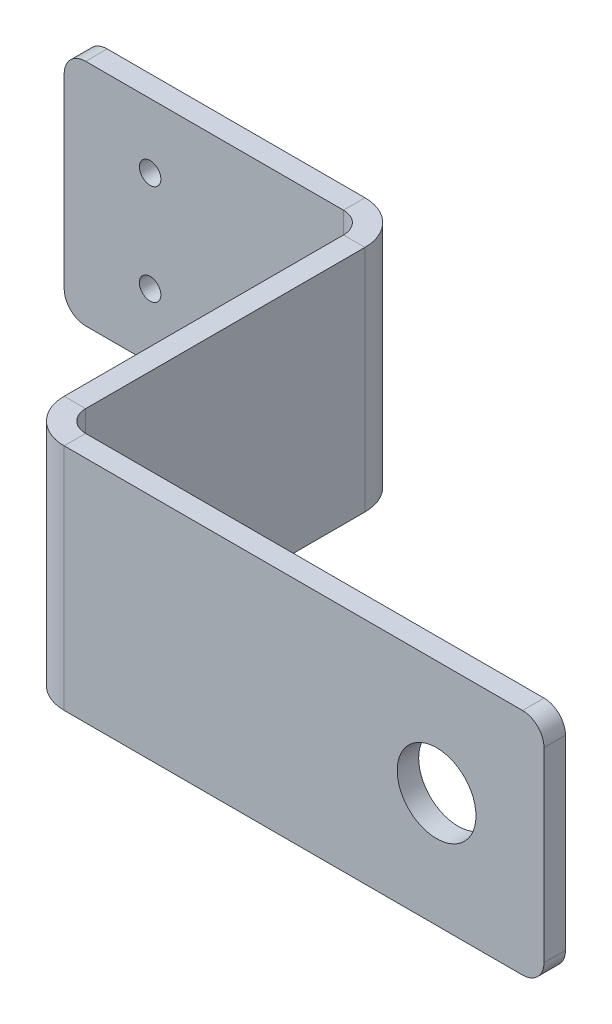
from build123d import *

# Parameters (mm, degrees)
BASE_FLANGE1_DEPTH = 32
CUT_EXTRUDE1_REACH = 130.658
SKETCH7_R          = 1.5
CUT_EXTRUDE2_REACH = 131.808
SKETCH8_R          = 5.5
FILLET1_R          = 3


# Sheet-metal steps are written as plain solids
with BuildPart() as part:
    # Sketch2 → Base-Flange1 (new body)
    with BuildSketch(Plane(origin=(0, 0, 0), x_dir=(1, 0, 0), z_dir=(0, 1, 0))):
        with BuildLine():
            Line((-115, 48), (-76, 48))
            ThreePointArc((-76, 48), (-71.757359313, 46.242640687), (-70, 42))
            Line((-70, 42), (-70, 3))
            ThreePointArc((-70, 3), (-69.121320344, 0.878679656), (-67, 0))
            Line((-67, 0), (0, 0))
            Line((0, 0), (0, -3))
            Line((0, -3), (-67, -3))
            ThreePointArc((-67, -3), (-71.242640687, -1.242640687), (-73, 3))
            Line((-73, 3), (-73, 42))
            ThreePointArc((-73, 42), (-73.878679656, 44.121320344), (-76, 45))
            Line((-76, 45), (-115, 45))
            Line((-115, 45), (-115, 48))
        make_face()
    extrude(amount=BASE_FLANGE1_DEPTH)

    # Sketch7 → Cut-Extrude1 (cut, up to next)
    with BuildSketch(Plane.XY.offset(-45), mode=Mode.PRIVATE) as cut_extrude1_sk1:
        with Locations((-103, 23)):
            Circle(SKETCH7_R)
    cut_extrude1_tool1 = extrude(cut_extrude1_sk1.sketch, amount=-CUT_EXTRUDE1_REACH, mode=Mode.PRIVATE) & part.part
    # Sketch7 → Cut-Extrude1 (cut, up to next)
    with BuildSketch(Plane.XY.offset(-45), mode=Mode.PRIVATE) as cut_extrude1_sk2:
        with Locations((-103, 9)):
            Circle(SKETCH7_R)
    cut_extrude1_tool2 = extrude(cut_extrude1_sk2.sketch, amount=-CUT_EXTRUDE1_REACH, mode=Mode.PRIVATE) & part.part
    add(cut_extrude1_tool1.solids().sort_by_distance((-103, 23, -45))[0], mode=Mode.SUBTRACT)
    add(cut_extrude1_tool2.solids().sort_by_distance((-103, 9, -45))[0], mode=Mode.SUBTRACT)

    # Sketch8 → Cut-Extrude2 (cut, up to next)
    with BuildSketch(Plane.XY.offset(3), mode=Mode.PRIVATE) as cut_extrude2_sk1:
        with Locations((-15, 16)):
            Circle(SKETCH8_R)
    cut_extrude2_tool1 = extrude(cut_extrude2_sk1.sketch, amount=-CUT_EXTRUDE2_REACH, mode=Mode.PRIVATE) & part.part
    add(cut_extrude2_tool1.solids().sort_by_distance((-15, 16, 3))[0], mode=Mode.SUBTRACT)

    # Fillet1
    fillet1_edges = [part.edges().sort_by_distance(p)[0] for p in [
        (-115, 0, -46.5),
        (0, 0, 1.5),
        (-115, 32, -46.5),
        (0, 32, 1.5),
    ]]
    fillet(fillet1_edges, radius=FILLET1_R)


solid = part.part
